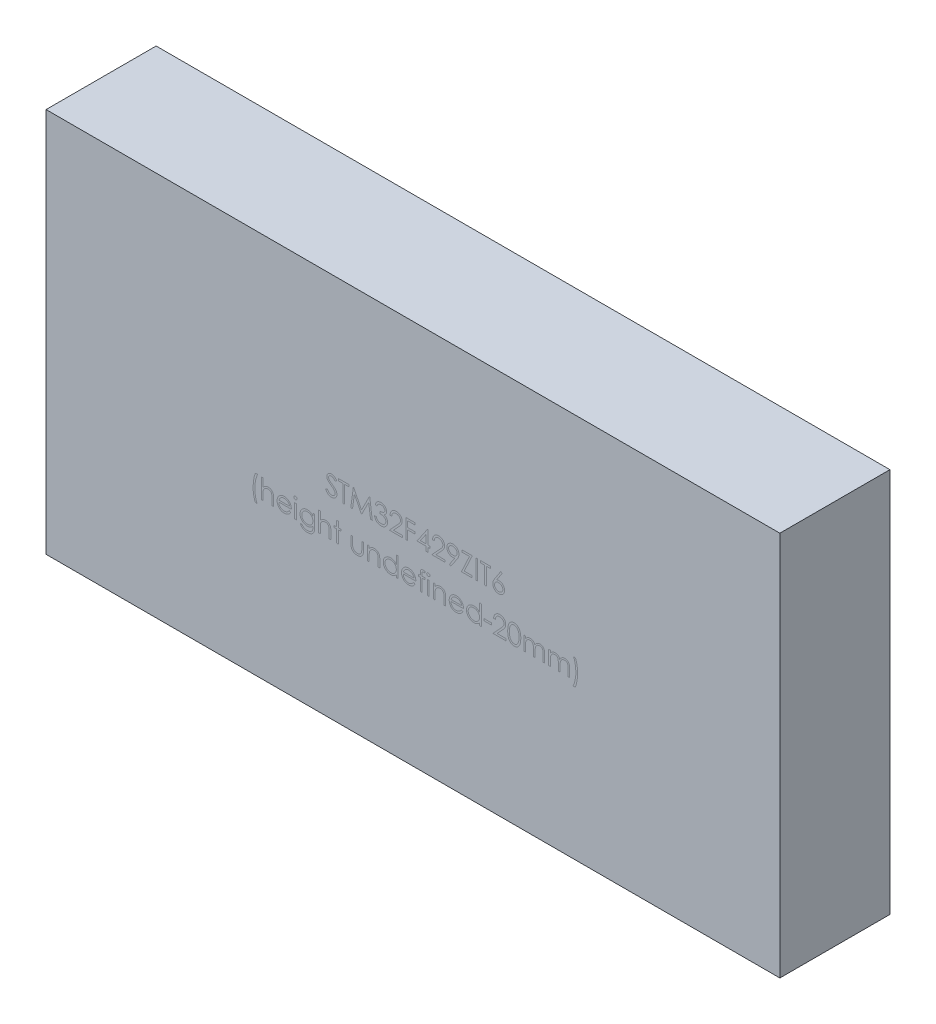
from build123d import *

# Parameters (mm, degrees)
SKETCH_1_W      = 133.34
SKETCH_1_H      = 70
EXTRUDE_1_DEPTH = 20


with BuildPart() as part:
    # 스케치1 → 보스-돌출1 (new body)
    with BuildSketch(Plane.XY):
        Rectangle(SKETCH_1_W, SKETCH_1_H)
    extrude(amount=EXTRUDE_1_DEPTH)


solid = part.part
